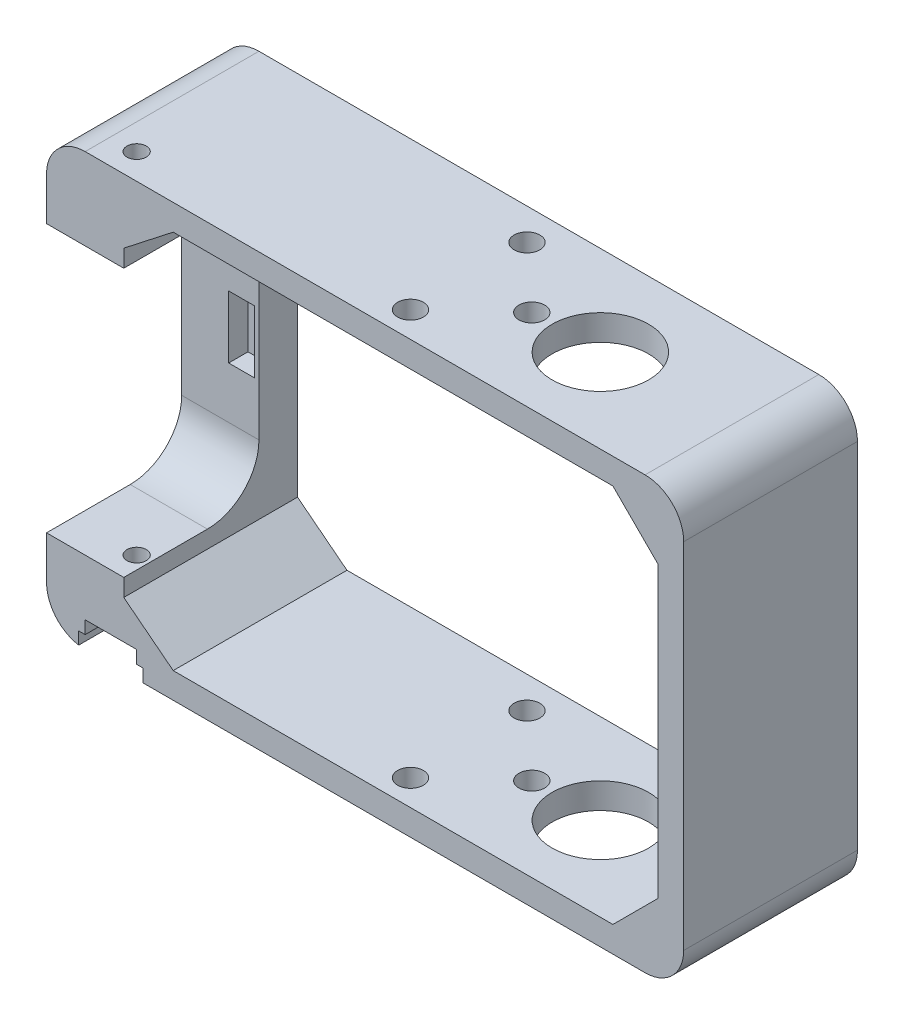
from build123d import *

# Parameters (mm, degrees)
SALIENTE_EXTRUIR1_DEPTH      = 3
SALIENTE_EXTRUIR1_DEPTH_BACK = 24
CROQUIS1_W                   = 99
CROQUIS1_H                   = 67
CROQUIS1_W_2                 = 83
CROQUIS1_H_2                 = 59
CHAFL_N1_SIZE                = 6
CHAFL_N1_SIZE2               = 7.679649793
CROQUIS10_R                  = 1.5
CORTAR_EXTRUIR6_DEPTH        = 97.317236256
CORTAR_EXTRUIR1_DEPTH        = 2
CORTAR_EXTRUIR5_DEPTH        = 2
CORTAR_EXTRUIR2_REACH        = 117.178
REDONDEO3_R                  = 6
CROQUIS12_R                  = 7.5
CROQUIS12_R_2                = 2
CORTAR_EXTRUIR7_DEPTH        = 70
CHAFL_N2_SIZE                = 7
CROQUIS17_W                  = 4
CROQUIS17_H                  = 9.7
CORTAR_EXTRUIR10_DEPTH       = 3


with BuildPart() as part:
    # Croquis1 → Saliente-Extruir1 (new, two sides: drawn at the far end of the back side and taken through both)
    with BuildSketch(Plane.XY.offset(-SALIENTE_EXTRUIR1_DEPTH_BACK)):
        with Locations((-15.4, 20.25)):
            Rectangle(CROQUIS1_W, CROQUIS1_H)
        with Locations((-11.4, 20.25)):
            Rectangle(CROQUIS1_W_2, CROQUIS1_H_2, mode=Mode.SUBTRACT)
    extrude(amount=SALIENTE_EXTRUIR1_DEPTH + SALIENTE_EXTRUIR1_DEPTH_BACK)

    # Chaflán1
    chafl_n1_edges = [part.edges().sort_by_distance(p)[0] for p in [
        (-52.9, 49.75, -10.5),
        (-52.9, -9.25, -10.5),
    ]]
    chafl_n1_side = [part.faces().sort_by_distance(p)[0] for p in [
        (-52.9, 20.25, -10.5),
    ]]
    chamfer(chafl_n1_edges, length=CHAFL_N1_SIZE, length2=CHAFL_N1_SIZE2, reference=chafl_n1_side[0])

    # Croquis10 → Cortar-Extruir6 (cut, through all)
    with BuildSketch(Plane(origin=(0, 53.75, 0), x_dir=(1, 0, 0), z_dir=(0, 1, 0))):
        with Locations((-54.9, 1)):
            Circle(CROQUIS10_R)
    extrude(amount=-CORTAR_EXTRUIR6_DEPTH, mode=Mode.SUBTRACT)

    # Croquis2 → Cortar-Extruir1 (cut)
    with BuildSketch(Plane(origin=(0, -13.25, 0), x_dir=(-1, 0, 0), z_dir=(0, -1, 0))):
        with BuildLine():
            Line((49.9, 1), (49.9, -3))
            Line((49.9, -3), (59.9, -3))
            Line((59.9, -3), (59.9, 1))
            ThreePointArc((59.9, 1), (54.9, 6), (49.9, 1))
        make_face()
    extrude(amount=-CORTAR_EXTRUIR1_DEPTH, mode=Mode.SUBTRACT)

    # Croquis9 → Cortar-Extruir5 (cut)
    with BuildSketch(Plane(origin=(0, -9.25, 0), x_dir=(1, 0, 0), z_dir=(0, 1, 0))):
        with BuildLine():
            Line((-57.389870926, 17.724817194), (-58.9, 1))
            Line((-58.9, 1), (-58.9, -3))
            Line((-58.9, -3), (-50.9, -3))
            Line((-50.9, -3), (-50.9, 1))
            Line((-50.9, 1), (-52.410129074, 17.724817194))
            ThreePointArc((-52.410129074, 17.724817194), (-54.9, 20), (-57.389870926, 17.724817194))
        make_face()
    extrude(amount=-CORTAR_EXTRUIR5_DEPTH, mode=Mode.SUBTRACT)

    # Croquis5 → Cortar-Extruir2 (cut, up to next)
    with BuildSketch(Plane.ZY.offset(64.9), mode=Mode.PRIVATE) as cortar_extruir2_sk1:
        with BuildLine():
            Line((-18, 33.05), (-18, 7.45))
            ThreePointArc((-18, 7.45), (-15.656854249, 1.793145751), (-10, -0.55))
            Line((-10, -0.55), (3, -0.55))
            Line((3, -0.55), (3, 41.05))
            Line((3, 41.05), (-10, 41.05))
            ThreePointArc((-10, 41.05), (-15.656854249, 38.706854249), (-18, 33.05))
        make_face()
    cortar_extruir2_tool1 = extrude(cortar_extruir2_sk1.sketch, amount=-CORTAR_EXTRUIR2_REACH, mode=Mode.PRIVATE) & part.part
    add(cortar_extruir2_tool1.solids().sort_by_distance((-64.9, 20.25, -7.217137))[0], mode=Mode.SUBTRACT)

    # Redondeo3
    redondeo3_edges = [part.edges().sort_by_distance(p)[0] for p in [
        (34.1, -13.25, -10.5),
        (34.1, 53.75, -10.5),
        (-64.9, -13.25, -10.5),
        (-64.9, 53.75, -10.5),
    ]]
    fillet(redondeo3_edges, radius=REDONDEO3_R)

    # Croquis12 → Cortar-Extruir7 (cut)
    with BuildSketch(Plane.XZ.offset(13.25)):
        with Locations((8.1, -10.05)):
            Circle(CROQUIS12_R)
        with Locations((-12.35, -1)):
            Circle(CROQUIS12_R_2)
        with Locations((-12.35, -19.1)):
            Circle(CROQUIS12_R_2)
        with Locations((-2.55, -10.05)):
            Circle(CROQUIS12_R_2)
    extrude(amount=-CORTAR_EXTRUIR7_DEPTH, mode=Mode.SUBTRACT)

    # Chaflán2
    chafl_n2_edges = [part.edges().sort_by_distance(p)[0] for p in [
        (30.1, 49.75, -10.5),
        (30.1, -9.25, -10.5),
    ]]
    chamfer(chafl_n2_edges, length=CHAFL_N2_SIZE)

    # Croquis17 → Cortar-Extruir10 (cut)
    with BuildSketch(Plane.XY.offset(-18)):
        with Locations((-55.6, 20.3)):
            Rectangle(CROQUIS17_W, CROQUIS17_H)
    extrude(amount=-CORTAR_EXTRUIR10_DEPTH, mode=Mode.SUBTRACT)


solid = part.part
